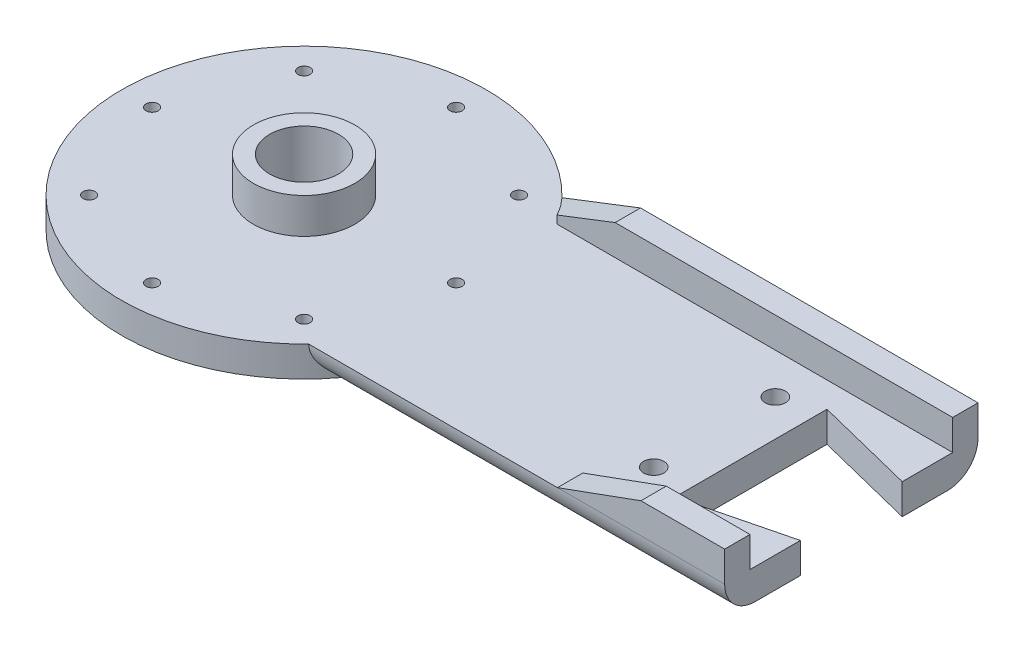
from build123d import *

# Parameters (mm, degrees)
CROQUIS1_R              = 3.399999868
CROQUIS1_R_2            = 0.599999638
CROQUIS1_R_3            = 0.999999893
CROQUIS1_R_4            = 1.000000486
SALIENTE_EXTRUIR1_DEPTH = 3
CROQUIS2_W              = 16.5
CROQUIS2_H              = 2.5
SALIENTE_EXTRUIR2_DEPTH = 3
CORTAR_EXTRUIR1_DEPTH   = 3
CORTAR_EXTRUIR2_DEPTH   = 3
CROQUIS5_R              = 5
CROQUIS5_R_2            = 3.399999868
SALIENTE_EXTRUIR3_DEPTH = 3.5
REDONDEO1_R             = 3


with BuildPart() as part:
    # Croquis1 → Saliente-Extruir1 (new body)
    with BuildSketch(Plane(origin=(0, 0, 0), x_dir=(1, 0, 0), z_dir=(0, 1, 0))):
        with BuildLine():
            Line((36.746468572, 5.153075413), (36.746468572, 12.628075318))
            Line((36.746468572, 12.628075318), (-4.308066759, 12.628075318))
            ThreePointArc((-4.308066759, 12.628075318), (-35.260081681, 0.11801537), (-4.299942386, -12.371924682))
            Line((-4.299942386, -12.371924682), (36.746468572, -12.371924682))
            Line((36.746468572, -12.371924682), (36.746468572, -4.896924777))
            Line((36.746468572, -4.896924777), (26.846467047, -7.371924682))
            Line((26.846467047, -7.371924682), (26.846467047, 7.628075318))
            Line((26.846467047, 7.628075318), (36.746468572, 5.153075413))
        make_face()
        with Locations(Location((-17.253531302, 0.128075481, 0), (0, 0, 270))):
            Circle(CROQUIS1_R, mode=Mode.SUBTRACT)
        with Locations(Location((-17.253531676, 15.128075105, 0), (0, 0, 270))):
            Circle(CROQUIS1_R_2, mode=Mode.SUBTRACT)
        with Locations(Location((23.24646788, 6.128075095, 0), (0, 0, 270))):
            Circle(CROQUIS1_R_3, mode=Mode.SUBTRACT)
        with Locations(Location((23.246467992, -5.871925124, 0), (0, 0, 270))):
            Circle(CROQUIS1_R_4, mode=Mode.SUBTRACT)
        with Locations(Location((-6.646930036, 10.734677061, 0), (0, 0, 270))):
            Circle(CROQUIS1_R_2, mode=Mode.SUBTRACT)
        with Locations(Location((-2.25353164, 0.128075566, 0), (0, 0, 270))):
            Circle(CROQUIS1_R_2, mode=Mode.SUBTRACT)
        with Locations(Location((-6.646929684, -10.478526074, 0), (0, 0, 270))):
            Circle(CROQUIS1_R_2, mode=Mode.SUBTRACT)
        with Locations(Location((-17.253531179, -14.871924469, 0), (0, 0, 270))):
            Circle(CROQUIS1_R_2, mode=Mode.SUBTRACT)
        with Locations(Location((-27.860132819, -10.478526425, 0), (0, 0, 270))):
            Circle(CROQUIS1_R_2, mode=Mode.SUBTRACT)
        with Locations(Location((-32.253531215, 0.12807507, 0), (0, 0, 270))):
            Circle(CROQUIS1_R_2, mode=Mode.SUBTRACT)
        with Locations(Location((-27.860133171, 10.73467671, 0), (0, 0, 270))):
            Circle(CROQUIS1_R_2, mode=Mode.SUBTRACT)
    extrude(amount=SALIENTE_EXTRUIR1_DEPTH)

    # Croquis2 → Saliente-Extruir2 (add)
    with BuildSketch(Plane(origin=(0, 3, 0), x_dir=(1, 0, 0), z_dir=(0, 1, 0))):
        with BuildLine():
            Line((36.746468572, 12.628075318), (-4.308066759, 12.628075318))
            ThreePointArc((-4.308066759, 12.628075318), (-3.24436155, 11.423127984), (-2.292413315, 10.128075318))
            Line((-2.292413315, 10.128075318), (36.746468572, 10.128075318))
            Line((36.746468572, 10.128075318), (36.746468572, 12.628075318))
        make_face()
        with Locations((28.496468572, -11.121924682)):
            Rectangle(CROQUIS2_W, CROQUIS2_H)
    extrude(amount=SALIENTE_EXTRUIR2_DEPTH)

    # Croquis3 → Cortar-Extruir1 (cut)
    with BuildSketch(Plane.XY.offset(12.371924682)):
        Polygon((20.246468572, 3), (28.486468572, 6), (20.246468572, 6), align=None)
    extrude(amount=-CORTAR_EXTRUIR1_DEPTH, mode=Mode.SUBTRACT)

    # Croquis4 → Cortar-Extruir2 (cut)
    with BuildSketch(Plane(origin=(0, 0, -12.628075318), x_dir=(-1, 0, 0), z_dir=(0, 0, -1))):
        Polygon((4.308066759, 3), (4.308066759, 6), (-3.441933241, 6), align=None)
    extrude(amount=-CORTAR_EXTRUIR2_DEPTH, mode=Mode.SUBTRACT)

    # Croquis5 → Saliente-Extruir3 (add)
    with BuildSketch(Plane(origin=(0, 3, 0), x_dir=(1, 0, 0), z_dir=(0, 1, 0))):
        with Locations(Location((-17.253531302, 0.128075481, 0), (0, 0, 270))):
            Circle(CROQUIS5_R)
        with Locations(Location((-17.253531302, 0.128075481, 0), (0, 0, 270))):
            Circle(CROQUIS5_R_2, mode=Mode.SUBTRACT)
    extrude(amount=SALIENTE_EXTRUIR3_DEPTH)

    # Redondeo1
    redondeo1_edges = [part.edges().sort_by_distance(p)[0] for p in [
        (16.219200907, 0, -12.628075318),
        (16.223263093, 0, 12.371924682),
    ]]
    fillet(redondeo1_edges, radius=REDONDEO1_R - 0.0001)  # a hair under: the kernel refuses the full size


solid = part.part
